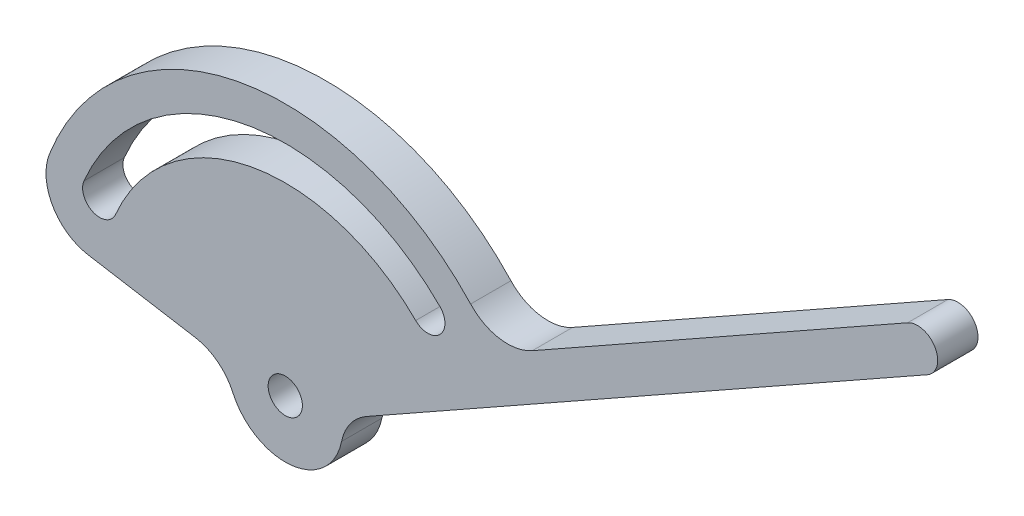
from build123d import *

# Parameters (mm, degrees)
SKETCH1_R               = 31.877
SKETCH1_R_2             = 2.159
BOSS_EXTRUDE1_DEPTH     = 5.08
BOSS_EXTRUDE4_START     = -5.08
BOSS_EXTRUDE4_DEPTH     = 5.08
CUT_EXTRUDE1_DEPTH      = 96.088150113
CUT_EXTRUDE1_DEPTH_BACK = 96.088150113
FILLET2_R               = 6.35


with BuildPart() as part:
    # Sketch1 → Boss-Extrude1 (new body)
    with BuildSketch(Plane.XY):
        Circle(SKETCH1_R)
        Circle(SKETCH1_R_2, mode=Mode.SUBTRACT)
        with BuildLine():
            ThreePointArc((19.487155783, 19.487155783), (-5.258505104, 27.052663549), (-25.368193256, 10.76815917))
            ThreePointArc((-25.368193256, 10.76815917), (-24.224411784, 7.937200685), (-21.393453299, 9.080982157))
            ThreePointArc((-21.393453299, 9.080982157), (-4.434591862, 22.813997371), (16.433868702, 16.433868702))
            ThreePointArc((16.433868702, 16.433868702), (19.487155783, 16.433868702), (19.487155783, 19.487155783))
        make_face(mode=Mode.SUBTRACT)
    extrude(amount=BOSS_EXTRUDE1_DEPTH)

    # Sketch2 → Boss-Extrude4 (add)
    with BuildSketch(Plane.XY.offset(5.08).offset(BOSS_EXTRUDE4_START)):
        with BuildLine():
            ThreePointArc((27.760306855, 15.668710614), (28.362979586, 14.549382048), (28.920542807, 13.406913618))
            Line((28.920542807, 13.406913618), (80.920581905, 42.757221913))
            ThreePointArc((80.920581905, 42.757221913), (81.884055709, 46.217701392), (78.423576229, 47.181175196))
            Line((78.423576229, 47.181175196), (26.423537131, 17.830866902))
            ThreePointArc((26.423537131, 17.830866902), (27.113483126, 16.763119094), (27.760306855, 15.668710614))
        make_face()
    extrude(amount=BOSS_EXTRUDE4_DEPTH)

    # Sketch6 → Cut-Extrude1 (cut, two sides: drawn at the far end of the back side and taken through both)
    with BuildSketch(Plane.XY.offset(5.08).offset(-CUT_EXTRUDE1_DEPTH_BACK)):
        with BuildLine():
            ThreePointArc((-31.612710273, 4.096300546), (4.846010768, -31.506496293), (28.920542807, 13.406913618))
            Line((28.920542807, 13.406913618), (7.151828818, 1.120029266))
            ThreePointArc((7.151828818, 1.120029266), (7.217174302, 0.561708192), (7.239, 0))
            ThreePointArc((7.239, 0), (0, -7.239), (-7.239, 0))
            Line((-7.239, 0), (-31.612710273, 4.096300546))
        make_face()
    extrude(amount=CUT_EXTRUDE1_DEPTH + CUT_EXTRUDE1_DEPTH_BACK, mode=Mode.SUBTRACT)

    # Fillet2
    fillet2_edges = [part.edges().sort_by_distance(p)[0] for p in [
        (7.151828818, 1.120029266, 2.54),
        (-7.239, 0, 2.54),
        (26.423537131, 17.830866902, 2.54),
        (-31.612710273, 4.096300546, 2.54),
    ]]
    fillet(fillet2_edges, radius=FILLET2_R)


solid = part.part
